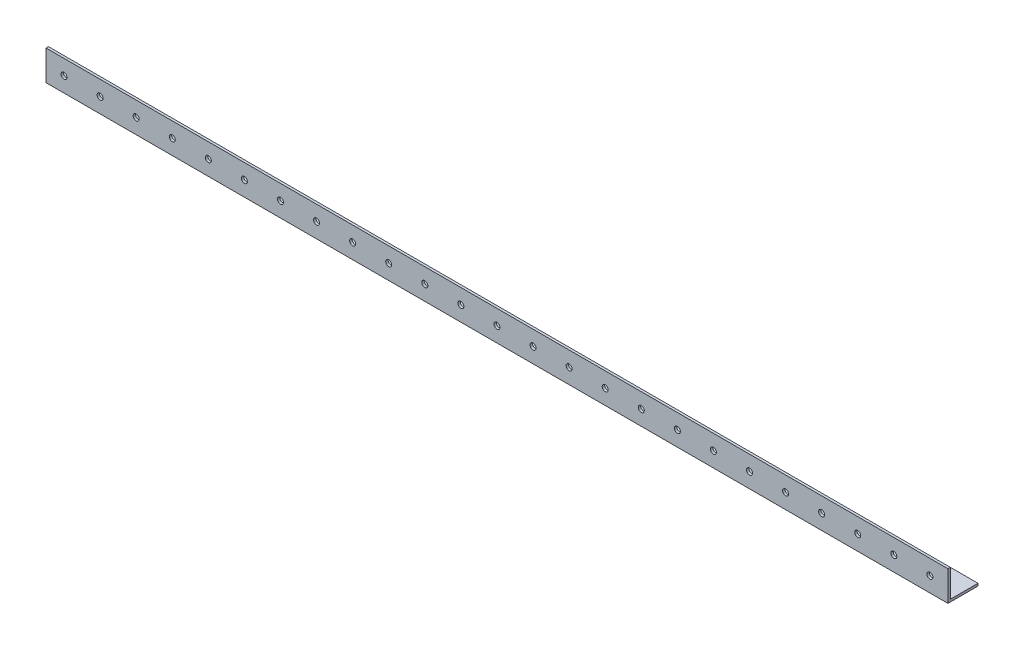
from build123d import *

# Parameters (mm, degrees)
EXTRUDE_1_DEPTH     = 1500
SKETCH_2_R          = 5
CUT_EXTRUDE_1_DEPTH = 1502.665741768
SKETCH_3_R          = 5
CUT_EXTRUDE_2_DEPTH = 1502.665741768


with BuildPart() as part:
    # Эскиз1 → Вытянуть-Тонкостенный1 (new body)
    with BuildSketch(Plane(origin=(0, 0, 0), x_dir=(0, 0, -1), z_dir=(1, 0, 0))):
        Polygon((50, 0), (0, 0), (0, 50), (4, 50), (4, 4), (50, 4), align=None)
    extrude(amount=EXTRUDE_1_DEPTH)

    # Эскиз2 → Вырез-Вытянуть1 (cut, through all)
    with BuildSketch(Plane.XY):
        with Locations((30, 25)):
            Circle(SKETCH_2_R)
        with Locations((90, 25)):
            Circle(SKETCH_2_R)
        with Locations((150, 25)):
            Circle(SKETCH_2_R)
        with Locations((210, 25)):
            Circle(SKETCH_2_R)
        with Locations((270, 25)):
            Circle(SKETCH_2_R)
        with Locations((330, 25)):
            Circle(SKETCH_2_R)
        with Locations((390, 25)):
            Circle(SKETCH_2_R)
        with Locations((450, 25)):
            Circle(SKETCH_2_R)
        with Locations((510, 25)):
            Circle(SKETCH_2_R)
        with Locations((570, 25)):
            Circle(SKETCH_2_R)
        with Locations((630, 25)):
            Circle(SKETCH_2_R)
        with Locations((690, 25)):
            Circle(SKETCH_2_R)
        with Locations((750, 25)):
            Circle(SKETCH_2_R)
        with Locations((810, 25)):
            Circle(SKETCH_2_R)
        with Locations((870, 25)):
            Circle(SKETCH_2_R)
        with Locations((930, 25)):
            Circle(SKETCH_2_R)
        with Locations((990, 25)):
            Circle(SKETCH_2_R)
        with Locations((1050, 25)):
            Circle(SKETCH_2_R)
        with Locations((1110, 25)):
            Circle(SKETCH_2_R)
        with Locations((1170, 25)):
            Circle(SKETCH_2_R)
        with Locations((1230, 25)):
            Circle(SKETCH_2_R)
        with Locations((1290, 25)):
            Circle(SKETCH_2_R)
        with Locations((1350, 25)):
            Circle(SKETCH_2_R)
        with Locations((1410, 25)):
            Circle(SKETCH_2_R)
        with Locations((1470, 25)):
            Circle(SKETCH_2_R)
    extrude(amount=-CUT_EXTRUDE_1_DEPTH, mode=Mode.SUBTRACT)

    # Эскиз3 → Вырез-Вытянуть2 (cut, through all)
    with BuildSketch(Plane.XZ):
        with Locations((30, -25)):
            Circle(SKETCH_3_R)
        with Locations((90, -25)):
            Circle(SKETCH_3_R)
        with Locations((150, -25)):
            Circle(SKETCH_3_R)
        with Locations((210, -25)):
            Circle(SKETCH_3_R)
        with Locations((270, -25)):
            Circle(SKETCH_3_R)
        with Locations((330, -25)):
            Circle(SKETCH_3_R)
        with Locations((390, -25)):
            Circle(SKETCH_3_R)
        with Locations((450, -25)):
            Circle(SKETCH_3_R)
        with Locations((510, -25)):
            Circle(SKETCH_3_R)
        with Locations((570, -25)):
            Circle(SKETCH_3_R)
        with Locations((630, -25)):
            Circle(SKETCH_3_R)
        with Locations((690, -25)):
            Circle(SKETCH_3_R)
        with Locations((750, -25)):
            Circle(SKETCH_3_R)
        with Locations((810, -25)):
            Circle(SKETCH_3_R)
        with Locations((870, -25)):
            Circle(SKETCH_3_R)
        with Locations((930, -25)):
            Circle(SKETCH_3_R)
        with Locations((990, -25)):
            Circle(SKETCH_3_R)
        with Locations((1050, -25)):
            Circle(SKETCH_3_R)
        with Locations((1110, -25)):
            Circle(SKETCH_3_R)
        with Locations((1170, -25)):
            Circle(SKETCH_3_R)
        with Locations((1230, -25)):
            Circle(SKETCH_3_R)
        with Locations((1290, -25)):
            Circle(SKETCH_3_R)
        with Locations((1350, -25)):
            Circle(SKETCH_3_R)
        with Locations((1410, -25)):
            Circle(SKETCH_3_R)
        with Locations((1470, -25)):
            Circle(SKETCH_3_R)
    extrude(amount=-CUT_EXTRUDE_2_DEPTH, mode=Mode.SUBTRACT)


solid = part.part
